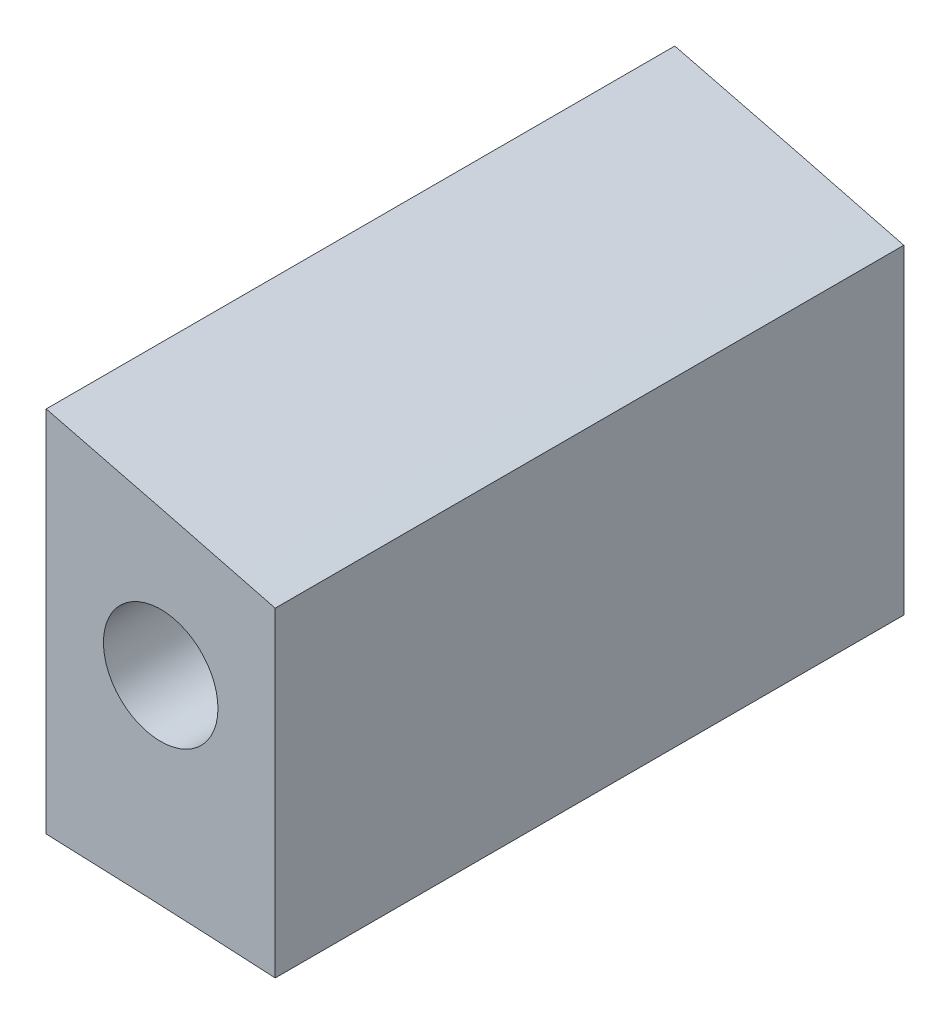
from build123d import *

# Parameters (mm, degrees)
BOSS_EXTRUDE1_DEPTH = 34.8615
SKETCH2_R           = 6.35
SKETCH2_R_2         = 3.175
SKETCH2_W           = 138.882076439
SKETCH2_H           = 152.274276667
CUT_EXTRUDE1_DEPTH  = 318.646799811
SKETCH3_W           = 293.18888876
SKETCH3_H           = 137.971241769
CUT_EXTRUDE2_DEPTH  = 242.109386719


with BuildPart() as part:
    # Sketch1 → Boss-Extrude1 (new body)
    with BuildSketch(Plane.XY):
        with BuildLine():
            add(Edge.make_bspline(
                [(0.000560351, 0.000130087), (0.810633127, 7.359196055), (8.649092025, 17.856605174), (26.286719818, 29.975176328), (52.111128271, 42.069215275), (89.597618475, 49.290763054), (131.400792109, 47.884831915), (173.256699242, 40.041104278), (217.961060472, 29.612974894), (256.952064401, 19.528920948), (290.35983767, 8.71099439), (301.273197721, 4.382828139), (314.816918223, -0.516206742), (309.846313895, 0.000130087)],
                knots=[0, 0, 0, 0, 0.060863618, 0.113688265, 0.188608742, 0.312908923, 0.448482434, 0.557612135, 0.691544113, 0.852438279, 0.92975597, 0.976058229, 1, 1, 1, 1], degree=3))
            add(Edge.make_bspline(
                [(309.846313895, 0.000130087), (303.956832565, 1.47095521), (293.989507544, 2.093987313), (276.26402299, 4.514356704), (260.846344817, 5.427413394), (235.858814759, 7.870306192), (205.101424636, 8.838080282), (157.718638092, 9.030650149), (110.497331172, 6.181495223), (66.506197185, -0.586669107), (36.454672816, -6.098499901), (15.316603331, -6.189065841), (1.230714189, -6.924076091), (0.000560351, 0.000130087)],
                knots=[0, 0, 0, 0, 0.057787081, 0.095274891, 0.171021118, 0.205339302, 0.335319146, 0.464904334, 0.658702312, 0.785511947, 0.893517288, 0.94309214, 1, 1, 1, 1], degree=3))
        make_face()
    extrude(amount=BOSS_EXTRUDE1_DEPTH)

    # Sketch2 → Cut-Extrude1 (cut, through all)
    with BuildSketch(Plane.XY.offset(34.8615)):
        with Locations((20.32, 10.16)):
            Circle(SKETCH2_R)
        with Locations((227.296313895, 19.050130087)):
            Circle(SKETCH2_R_2)
        with Locations((303.087352115, 19.854149729)):
            Rectangle(SKETCH2_W, SKETCH2_H)
    extrude(amount=-CUT_EXTRUDE1_DEPTH, mode=Mode.SUBTRACT)

    # Sketch3 → Cut-Extrude2 (cut, through all)
    with BuildSketch(Plane.XY.offset(34.8615)):
        with Locations((74.351869515, 19.480058122)):
            Rectangle(SKETCH3_W, SKETCH3_H)
    extrude(amount=-CUT_EXTRUDE2_DEPTH, mode=Mode.SUBTRACT)


solid = part.part
